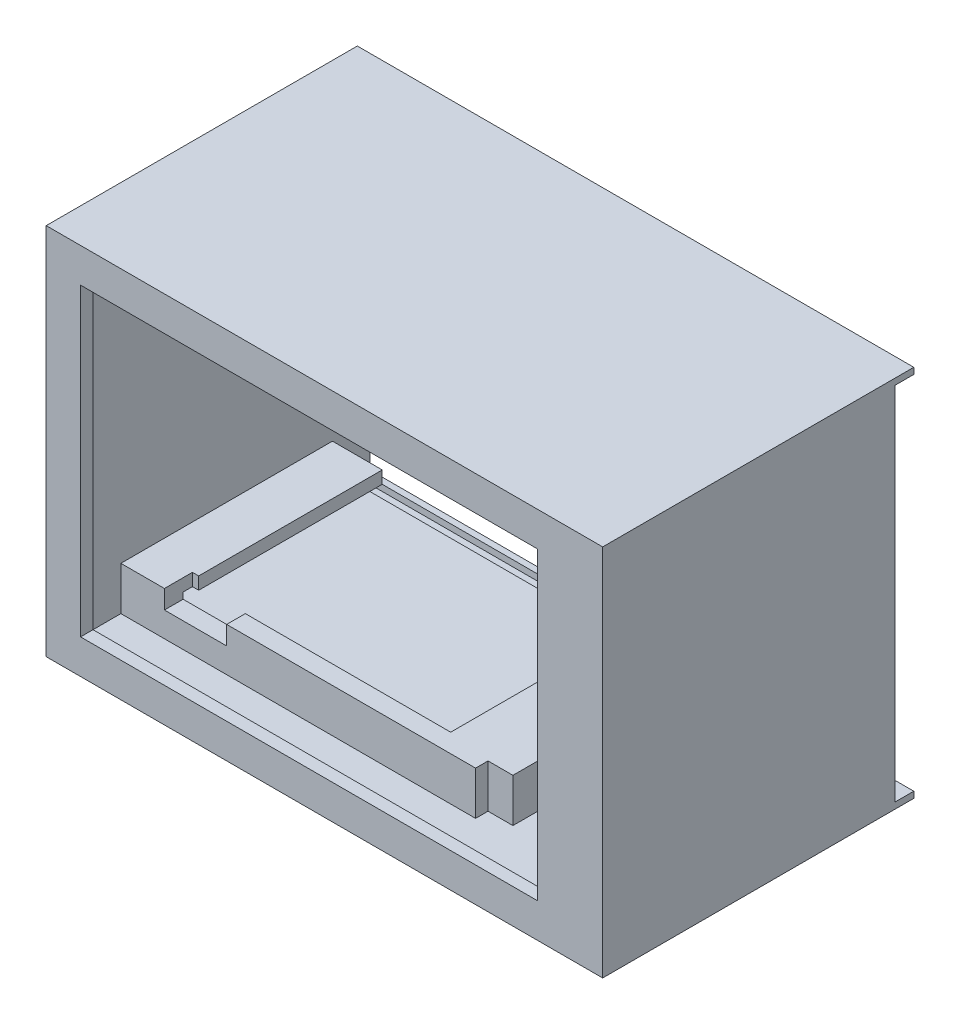
from build123d import *

# Parameters (mm, degrees)
SKETCH_1_W           = 89.43
SKETCH_1_H           = 60
EXTRUDE_2_DEPTH      = 50
EXTRUDE_START        = -50
EXTRUDE_3_OUTLINE_W  = 85.42
EXTRUDE_3_OUTLINE_H  = 56
EXTRUDE_3_DEPTH      = 50
SKETCH_3_W           = 89.43
SKETCH_3_H           = 60
EXTRUDE_4_DEPTH      = 2
EXTRUDE_START_2      = -2
EXTRUDE_5_OUTLINE_W  = 73.44
EXTRUDE_5_OUTLINE_H  = 48.96
EXTRUDE_5_DEPTH      = 2
SKETCH_6_W           = 2
SKETCH_6_H           = 12
CUT_EXTRUDE_6_DEPTH  = 10
SKETCH_8_W           = 6
SKETCH_8_H           = 16
CUT_EXTRUDE_7_DEPTH  = 10
DRAFT_2_ANGLE        = 45
SKETCH_9_W           = 61
SKETCH_9_H           = 3
EXTRUDE_5_2_DEPTH    = 7
SKETCH_10_W          = 3
SKETCH_10_H          = 40
EXTRUDE_6_DEPTH      = 7
SKETCH_11_W          = 8
SKETCH_11_H          = 2
EXTRUDE_7_DEPTH      = 20
SKETCH_12_W          = 3
SKETCH_12_H          = 7
CUT_EXTRUDE_8_DEPTH  = 6
SKETCH_13_W          = 8
SKETCH_13_H          = 2
EXTRUDE_8_DEPTH      = 11
SKETCH_14_W          = 3
SKETCH_14_H          = 56
CUT_EXTRUDE_10_DEPTH = 11
SKETCH_15_W          = 87.425
SKETCH_15_H          = 2
CUT_EXTRUDE_11_DEPTH = 1
SKETCH_16_W          = 87.425
SKETCH_16_H          = 2
CUT_EXTRUDE_12_DEPTH = 1
SKETCH_17_R          = 3
CUT_EXTRUDE_13_DEPTH = 5.4
EXTRUDE_9_DEPTH      = 3.6
SKETCH_20_W          = 3
SKETCH_20_H          = 2
EXTRUDE_10_DEPTH     = 7
CUT_EXTRUDE_15_DEPTH = 7
SKETCH_22_W          = 32
SKETCH_22_H          = 58
CUT_EXTRUDE_16_DEPTH = 1
SKETCH_25_W          = 3
SKETCH_25_H          = 2
CUT_EXTRUDE_18_DEPTH = 2
SKETCH_27_W          = 4
SKETCH_27_H          = 2
CUT_EXTRUDE_19_DEPTH = 2
SKETCH_29_W          = 2.005
SKETCH_29_H          = 11.917011913
EXTRUDE_12_DEPTH     = 17
SKETCH_31_W          = 1.611039623
SKETCH_31_H          = 56
SKETCH_31_W_2        = 2
CUT_EXTRUDE_20_DEPTH = 48
SKETCH_34_W          = 8.005
SKETCH_34_H          = 34
EXTRUDE_13_DEPTH     = 2
SKETCH_35_W          = 8.005
SKETCH_35_H          = 3
EXTRUDE_14_DEPTH     = 8
SKETCH_36_R          = 3
CUT_EXTRUDE_21_DEPTH = 8
SKETCH_37_W          = 4
SKETCH_37_H          = 2
CUT_EXTRUDE_22_DEPTH = 5
SKETCH_38_W          = 10
SKETCH_38_H          = 3
CUT_EXTRUDE_23_DEPTH = 4.5
SKETCH_39_W          = 1.5
SKETCH_39_H          = 5
CUT_EXTRUDE_24_DEPTH = 20


# Read off the part's stored shape, not the designer's step: 切除-拉伸3, 切除-拉伸5
with BuildPart() as part:
    # 草图1 → 凸台-拉伸2 (new body)
    with BuildSketch(Plane.XY):
        Rectangle(SKETCH_1_W, SKETCH_1_H)
    extrude(amount=EXTRUDE_2_DEPTH)

    # 切除-拉伸3 outline → 切除-拉伸3 (cut)
    with BuildSketch(Plane.XY.offset(50).offset(EXTRUDE_START)):
        Rectangle(EXTRUDE_3_OUTLINE_W, EXTRUDE_3_OUTLINE_H)
    extrude(amount=EXTRUDE_3_DEPTH, mode=Mode.SUBTRACT)

    # 草图3 → 凸台-拉伸4 (add)
    with BuildSketch(Plane.XY.offset(50)):
        Rectangle(SKETCH_3_W, SKETCH_3_H)
    extrude(amount=-EXTRUDE_4_DEPTH)

    # Extrude 5 outline → Extrude 5 (cut)
    with BuildSketch(Plane.XY.offset(50).offset(EXTRUDE_START_2)):
        with Locations((-2.475, 0)):
            Rectangle(EXTRUDE_5_OUTLINE_W, EXTRUDE_5_OUTLINE_H)
    extrude(amount=EXTRUDE_5_DEPTH, mode=Mode.SUBTRACT)

    # 草图6 → 切除-拉伸6 (cut)
    with BuildSketch(Plane.ZY.offset(44.715)):
        with Locations((26.25, 14.9)):
            Rectangle(SKETCH_6_W, SKETCH_6_H)
    extrude(amount=-CUT_EXTRUDE_6_DEPTH, mode=Mode.SUBTRACT)

    # 草图8 → 切除-拉伸7 (cut)
    with BuildSketch(Plane.ZY.offset(44.715)):
        with Locations((26.25, 14.9)):
            Rectangle(SKETCH_8_W, SKETCH_8_H)
    extrude(amount=-CUT_EXTRUDE_7_DEPTH, mode=Mode.SUBTRACT)

    # 拔模2
    draft_2_faces = [part.faces().sort_by_distance(p)[0] for p in [
        (-43.7125, 22.9, 26.25),
        (-43.7125, 14.9, 23.25),
        (-43.7125, 6.9, 26.25),
        (-43.7125, 14.9, 29.25),
    ]]
    draft(draft_2_faces, Plane(origin=(-44.715, 30, 50), x_dir=(0, -1, 0), z_dir=(-1, 0, 0)), DRAFT_2_ANGLE)

    # 草图9 → Extrude 5 2 (add)
    with BuildSketch(Plane(origin=(0, -28, 0), x_dir=(1, 0, 0), z_dir=(0, 1, 0))):
        with Locations((-12.21, -38.5)):
            Rectangle(SKETCH_9_W, SKETCH_9_H)
    extrude(amount=EXTRUDE_5_2_DEPTH)

    # 草图10 → 凸台-拉伸6 (add)
    with BuildSketch(Plane(origin=(0, -28, 0), x_dir=(1, 0, 0), z_dir=(0, 1, 0))):
        with Locations((16.79, -20)):
            Rectangle(SKETCH_10_W, SKETCH_10_H)
    extrude(amount=EXTRUDE_6_DEPTH)

    # 草图11 → 凸台-拉伸7 (add)
    with BuildSketch(Plane(origin=(0, 0, 37), x_dir=(-1, 0, 0), z_dir=(0, 0, -1))):
        with Locations((-11.29, -22)):
            Rectangle(SKETCH_11_W, SKETCH_11_H)
        with Locations((38.71, -22)):
            Rectangle(SKETCH_11_W, SKETCH_11_H)
    extrude(amount=EXTRUDE_7_DEPTH)

    # 草图12 → 切除-拉伸8 (cut)
    with BuildSketch(Plane(origin=(0, 0, 0), x_dir=(-1, 0, 0), z_dir=(0, 0, -1))):
        with Locations((-16.79, -24.5)):
            Rectangle(SKETCH_12_W, SKETCH_12_H)
    extrude(amount=-CUT_EXTRUDE_8_DEPTH, mode=Mode.SUBTRACT)

    # 草图13 → 凸台-拉伸8 (add)
    with BuildSketch(Plane(origin=(0, 0, 17), x_dir=(-1, 0, 0), z_dir=(0, 0, -1))):
        with Locations((-11.29, -22)):
            Rectangle(SKETCH_13_W, SKETCH_13_H)
        with Locations((38.71, -22)):
            Rectangle(SKETCH_13_W, SKETCH_13_H)
    extrude(amount=EXTRUDE_8_DEPTH)

    # 草图14 → 切除-拉伸10 (cut)
    with BuildSketch(Plane(origin=(44.715, 0, 0), x_dir=(0, 0, -1), z_dir=(1, 0, 0))):
        with Locations((-1.5, 0)):
            Rectangle(SKETCH_14_W, SKETCH_14_H)
    extrude(amount=-CUT_EXTRUDE_10_DEPTH, mode=Mode.SUBTRACT)

    # 草图15 → 切除-拉伸11 (cut)
    with BuildSketch(Plane.XZ.offset(-28)):
        with Locations((1.0025, 2)):
            Rectangle(SKETCH_15_W, SKETCH_15_H)
    extrude(amount=-CUT_EXTRUDE_11_DEPTH, mode=Mode.SUBTRACT)

    # 草图16 → 切除-拉伸12 (cut)
    with BuildSketch(Plane(origin=(0, -28, 0), x_dir=(1, 0, 0), z_dir=(0, 1, 0))):
        with Locations((1.0025, -2)):
            Rectangle(SKETCH_16_W, SKETCH_16_H)
    extrude(amount=-CUT_EXTRUDE_12_DEPTH, mode=Mode.SUBTRACT)

    # 草图17 → 切除-拉伸13 (cut)
    with BuildSketch(Plane.ZY.offset(44.715)):
        with Locations(Location((11.4, 18, 0), (0, 0, 270))):
            Circle(SKETCH_17_R)
    extrude(amount=-CUT_EXTRUDE_13_DEPTH, mode=Mode.SUBTRACT)

    # 草图18 → 凸台-拉伸9 (add)
    with BuildSketch(Plane(origin=(0, -28, 0), x_dir=(1, 0, 0), z_dir=(0, 1, 0))):
        Polygon((18.29, -25), (18.29, -27), (40.29, -27), (40.29, -18), (38.29, -18), (38.29, -25), align=None)
    extrude(amount=EXTRUDE_9_DEPTH)

    # 草图20 → 凸台-拉伸10 (add)
    with BuildSketch(Plane(origin=(0, 0, 25), x_dir=(-1, 0, 0), z_dir=(0, 0, -1))):
        with Locations((-36.79, -25.4)):
            Rectangle(SKETCH_20_W, SKETCH_20_H)
        with Locations((-19.79, -25.4)):
            Rectangle(SKETCH_20_W, SKETCH_20_H)
    extrude(amount=EXTRUDE_10_DEPTH)

    # 草图21 → 切除-拉伸15 (cut)
    with BuildSketch(Plane(origin=(0, -28, 0), x_dir=(1, 0, 0), z_dir=(0, 1, 0))):
        with BuildLine():
            Line((25.28, -20), (31.3, -20))
            ThreePointArc((31.3, -20), (32.353589104, -20.436410896), (32.79, -21.49))
            Line((32.79, -21.49), (32.79, -21.51))
            ThreePointArc((32.79, -21.51), (32.353589104, -22.563589104), (31.3, -23))
            Line((31.3, -23), (25.28, -23))
            ThreePointArc((25.28, -23), (24.226410896, -22.563589104), (23.79, -21.51))
            Line((23.79, -21.51), (23.79, -21.49))
            ThreePointArc((23.79, -21.49), (24.226410896, -20.436410896), (25.28, -20))
        make_face()
    extrude(amount=-CUT_EXTRUDE_15_DEPTH, mode=Mode.SUBTRACT)

    # 草图22 → 切除-拉伸16 (cut)
    with BuildSketch(Plane(origin=(0, 0, 0), x_dir=(-1, 0, 0), z_dir=(0, 0, -1))):
        with Locations((-28.715, 0)):
            Rectangle(SKETCH_22_W, SKETCH_22_H)
    extrude(amount=-CUT_EXTRUDE_16_DEPTH, mode=Mode.SUBTRACT)

    # 草图25 → 切除-拉伸18 (cut)
    with BuildSketch(Plane(origin=(0, -21, 0), x_dir=(1, 0, 0), z_dir=(0, 1, 0))):
        with Locations((16.79, -39)):
            Rectangle(SKETCH_25_W, SKETCH_25_H)
    extrude(amount=-CUT_EXTRUDE_18_DEPTH, mode=Mode.SUBTRACT)

    # 草图27 → 切除-拉伸19 (cut)
    with BuildSketch(Plane(origin=(0, -21, 0), x_dir=(1, 0, 0), z_dir=(0, 1, 0))):
        with Locations((16.29, -39)):
            Rectangle(SKETCH_27_W, SKETCH_27_H)
    extrude(amount=-CUT_EXTRUDE_19_DEPTH, mode=Mode.SUBTRACT)

    # 草图29 → 凸台-拉伸12 (add)
    with BuildSketch(Plane(origin=(0, 0, 0), x_dir=(-1, 0, 0), z_dir=(0, 0, -1))):
        with Locations((43.7125, 17.342942197)):
            Rectangle(SKETCH_29_W, SKETCH_29_H)
    extrude(amount=-EXTRUDE_12_DEPTH)

    # 草图31 → 切除-拉伸20 (cut)
    with BuildSketch(Plane(origin=(0, 0, 0), x_dir=(-1, 0, 0), z_dir=(0, 0, -1))):
        with Locations((-41.909480188, 0)):
            Rectangle(SKETCH_31_W, SKETCH_31_H)
        with Locations((41.715, 0)):
            Rectangle(SKETCH_31_W_2, SKETCH_31_H)
    extrude(amount=-CUT_EXTRUDE_20_DEPTH, mode=Mode.SUBTRACT)

    # 草图34 → 凸台-拉伸13 (add)
    with BuildSketch(Plane(origin=(0, -21, 0), x_dir=(1, 0, 0), z_dir=(0, 1, 0))):
        with Locations((-38.7125, -23)):
            Rectangle(SKETCH_34_W, SKETCH_34_H)
    extrude(amount=-EXTRUDE_13_DEPTH)

    # 草图35 → 凸台-拉伸14 (add)
    with BuildSketch(Plane(origin=(0, -21, 0), x_dir=(1, 0, 0), z_dir=(0, 1, 0))):
        with Locations((-38.7125, -38.5)):
            Rectangle(SKETCH_35_W, SKETCH_35_H)
    extrude(amount=-EXTRUDE_14_DEPTH)

    # 草图36 → 切除-拉伸21 (cut)
    with BuildSketch(Plane(origin=(-42.715, 0, 0), x_dir=(0, 0, -1), z_dir=(1, 0, 0))):
        with Locations(Location((-5.6, 14.8, 0), (0, 0, 90))):
            Circle(SKETCH_36_R)
    extrude(amount=-CUT_EXTRUDE_21_DEPTH, mode=Mode.SUBTRACT)

    # 草图37 → 切除-拉伸22 (cut)
    with BuildSketch(Plane(origin=(0, -23, 0), x_dir=(1, 0, 0), z_dir=(0, 1, 0))):
        with Locations((16.29, -39)):
            Rectangle(SKETCH_37_W, SKETCH_37_H)
    extrude(amount=-CUT_EXTRUDE_22_DEPTH, mode=Mode.SUBTRACT)

    # 草图38 → 切除-拉伸23 (cut)
    with BuildSketch(Plane.XY.offset(40)):
        with Locations((-30.715, -22.5)):
            Rectangle(SKETCH_38_W, SKETCH_38_H)
    extrude(amount=-CUT_EXTRUDE_23_DEPTH, mode=Mode.SUBTRACT)

    # 草图39 → 切除-拉伸24 (cut)
    with BuildSketch(Plane(origin=(0, 0, 6), x_dir=(-1, 0, 0), z_dir=(0, 0, -1))):
        with Locations((-16.04, -25.5)):
            Rectangle(SKETCH_39_W, SKETCH_39_H)
    extrude(amount=-CUT_EXTRUDE_24_DEPTH, mode=Mode.SUBTRACT)


solid = part.part
